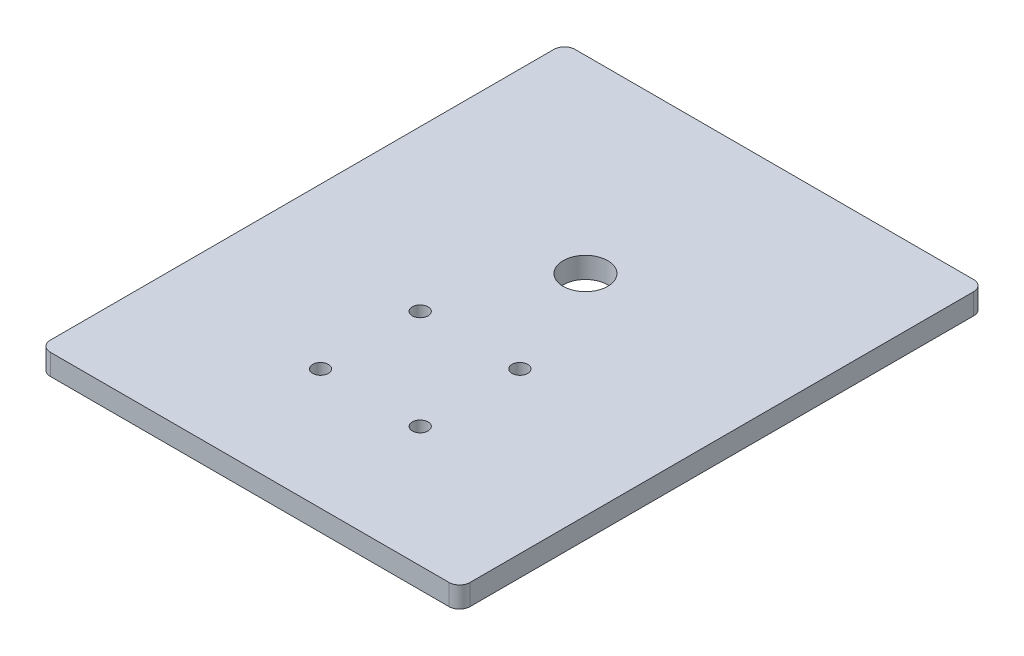
from build123d import *

# Parameters (mm, degrees)
IZIM2_W               = 160
IZIM2_H               = 200
TABAN_FLAN_1_DEPTH    = 8
K_ELERI_START         = -8
K_ELERI_K_R1_DEPTH    = 8
IZIM3_R               = 8.5
KES_EKSTR_ZYON1_DEPTH = 216.555097365
IZIM4_R               = 3
KES_EKSTR_ZYON2_DEPTH = 216.555097365


# Read off the part's stored shape, not the designer's step: Köşeleri kır1
# Sheet-metal steps are written as plain solids
with BuildPart() as part:
    # Çizim2 → Taban-Flanş1 (new body)
    with BuildSketch(Plane(origin=(0, 0, 0), x_dir=(1, 0, 0), z_dir=(0, 1, 0))):
        with Locations((0, -100)):
            Rectangle(IZIM2_W, IZIM2_H)
    extrude(amount=-TABAN_FLAN_1_DEPTH)

    # Köşeleri kır1 outline → Köşeleri kır1 (cut)
    with BuildSketch(Plane(origin=(0, 0, 0), x_dir=(1, 0, 0), z_dir=(0, 1, 0)).offset(K_ELERI_START)):
        with BuildLine():
            ThreePointArc((80, -196), (78.828427125, -198.828427125), (76, -200))
            Line((76, -200), (80, -200))
            Line((80, -200), (80, -196))
        make_face()
        with BuildLine():
            Line((-80, -200), (-76, -200))
            ThreePointArc((-76, -200), (-78.828427125, -198.828427125), (-80, -196))
            Line((-80, -196), (-80, -200))
        make_face()
        with BuildLine():
            ThreePointArc((76, 0), (78.828427125, -1.171572875), (80, -4))
            Line((80, -4), (80, 0))
            Line((80, 0), (76, 0))
        make_face()
        with BuildLine():
            Line((-80, 0), (-80, -4))
            ThreePointArc((-80, -4), (-78.828427125, -1.171572875), (-76, 0))
            Line((-76, 0), (-80, 0))
        make_face()
    extrude(amount=K_ELERI_K_R1_DEPTH, mode=Mode.SUBTRACT)

    # Çizim3 → Kes-Ekstrüzyon1 (cut, through all)
    with BuildSketch(Plane(origin=(0, 0, 0), x_dir=(1, 0, 0), z_dir=(0, 1, 0))):
        with Locations(Location((0, -72, 0), (0, 0, 270))):
            Circle(IZIM3_R)
    extrude(amount=-KES_EKSTR_ZYON1_DEPTH, mode=Mode.SUBTRACT)

    # Çizim4 → Kes-Ekstrüzyon2 (cut, through all)
    with BuildSketch(Plane(origin=(0, 0, 0), x_dir=(1, 0, 0), z_dir=(0, 1, 0))):
        with Locations(Location((-19, -116, 0), (0, 0, 270))):
            Circle(IZIM4_R)
        with Locations(Location((19, -116, 0), (0, 0, 270))):
            Circle(IZIM4_R)
        with Locations(Location((19, -154, 0), (0, 0, 270))):
            Circle(IZIM4_R)
        with Locations(Location((-19, -154, 0), (0, 0, 270))):
            Circle(IZIM4_R)
    extrude(amount=-KES_EKSTR_ZYON2_DEPTH, mode=Mode.SUBTRACT)


solid = part.part
